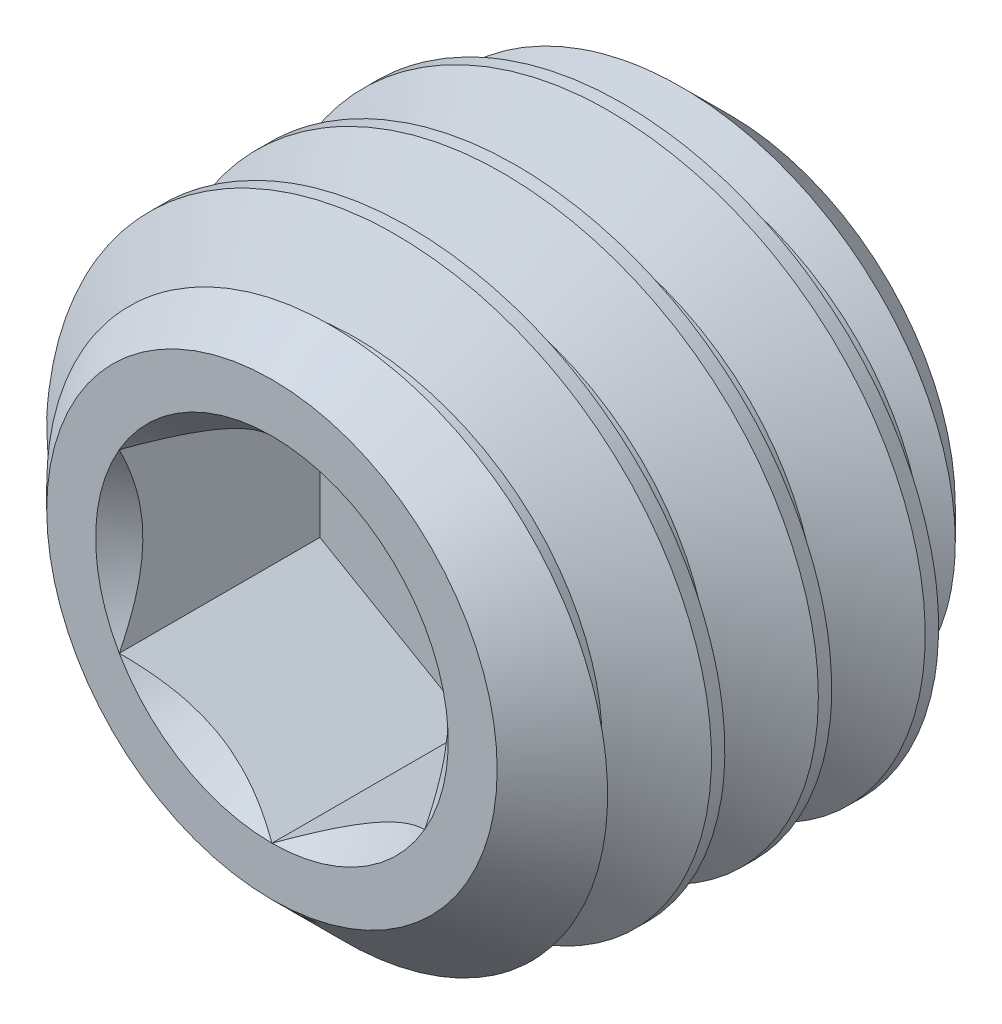
from build123d import *

# Parameters (mm, degrees)
SKETCH2_W          = 3
SKETCH2_H          = 2
CHAMFER1_SIZE      = 0.525
CUT_EXTRUDE1_DEPTH = 1.314
CUT_SWEEP1_PITCH   = 0.7


with BuildPart() as part:
    # Sketch2 → Revolve1 (revolve)
    with BuildSketch(Plane(origin=(0, 0, 0), x_dir=(0, 0, -1), z_dir=(1, 0, 0)), mode=Mode.PRIVATE) as revolve1_sk:
        with Locations((0, 1)):
            Rectangle(SKETCH2_W, SKETCH2_H)
    revolve(revolve1_sk.sketch.rotate(Axis((0, 0, 1.5), (0, 0, -1)), 90), axis=Axis((0, 0, 1.5), (0, 0, -1)))

    # Chamfer1
    chamfer1_edges = [part.edges().sort_by_distance(p)[0] for p in [
        (-2, 0, -1.5),
        (-2, 0, 1.5),
    ]]
    chamfer(chamfer1_edges, length=CHAMFER1_SIZE)

    # Sketch3 → Cut-Extrude1 (cut)
    with BuildSketch(Plane.XY.offset(1.5)):
        Polygon((0, 1.154700538), (-1, 0.577350269), (-1, -0.577350269), (0, -1.154700538), (1, -0.577350269), (1, 0.577350269), align=None)
    extrude(amount=-CUT_EXTRUDE1_DEPTH, mode=Mode.SUBTRACT)

    # Cut-Extrude2 cone 1 section (through the dimple's axis) → Cut-Extrude2 (revolve, cut)
    with BuildSketch(Plane(origin=(0, 0, 1.5), x_dir=(0, -1, 0), z_dir=(1, 0, 0))):
        Polygon((0, 0), (1.154700538, 0), (0, 1.154700538), align=None)
    revolve(axis=Axis((0, 0, 1.5), (0, 0, -1)), mode=Mode.SUBTRACT)

    # Cut-Sweep1: the profile of Sketch6 screwed along a right-hand helix of 5.285714 turns, 6 arcs to a turn; built about Z, then put on its axis
    cut_sweep1_z = Axis((0, 0, 0), (0, 0, 1))
    cut_sweep1_corners = [(2.037888611, 0, -0.634375), (2.037888611, 0, 0.021875), (1.545336663, 0, -0.2625), (1.545336663, 0, -0.35)]
    with BuildLine(mode=Mode.PRIVATE) as cut_sweep1_profile:
        Line(cut_sweep1_corners[0], cut_sweep1_corners[1])
        Line(cut_sweep1_corners[1], cut_sweep1_corners[2])
        Line(cut_sweep1_corners[2], cut_sweep1_corners[3])
        Line(cut_sweep1_corners[3], cut_sweep1_corners[0])
    cut_sweep1_cap = Face(cut_sweep1_profile.wire())
    cut_sweep1_turn_angles = [0, 30, 60, 90, 120, 150, 180, 210, 240, 270, 300, 330, 360]
    cut_sweep1_turn_weights = [1, 0.8660254037844387, 1, 0.8660254037844387, 1, 0.8660254037844387, 1, 0.8660254037844387, 1, 0.8660254037844387, 1, 0.8660254037844387, 1]
    cut_sweep1_turn_rails = [Edge.make_bspline([Vector(p[0], p[1], 0).rotate(cut_sweep1_z, cut_sweep1_turn_angles[k]) / cut_sweep1_turn_weights[k] + Vector(0, 0, p[2] + CUT_SWEEP1_PITCH * cut_sweep1_turn_angles[k] / 360) for k in range(13)], [0, 0, 0, 1, 1, 2, 2, 3, 3, 4, 4, 5, 5, 6, 6, 6], 2, cut_sweep1_turn_weights) for p in cut_sweep1_corners]
    cut_sweep1_turn_sides = [Face.make_surface_from_curves(cut_sweep1_turn_rails[p[0]], cut_sweep1_turn_rails[p[1]]) for p in [(0, 1), (1, 2), (2, 3), (3, 0)]]
    cut_sweep1_last_angles = [1800, 1830, 1860, 1881.428571429, 1902.857142857]
    cut_sweep1_last_weights = [1, 0.8660254037844387, 1, 0.930873748644186, 1]
    cut_sweep1_last_rails = [Edge.make_bspline([Vector(p[0], p[1], 0).rotate(cut_sweep1_z, cut_sweep1_last_angles[k]) / cut_sweep1_last_weights[k] + Vector(0, 0, p[2] + CUT_SWEEP1_PITCH * cut_sweep1_last_angles[k] / 360) for k in range(5)], [0, 0, 0, 1, 1, 2, 2, 2], 2, cut_sweep1_last_weights) for p in cut_sweep1_corners]
    cut_sweep1_last_sides = [Face.make_surface_from_curves(cut_sweep1_last_rails[p[0]], cut_sweep1_last_rails[p[1]]) for p in [(0, 1), (1, 2), (2, 3), (3, 0)]]
    cut_sweep1 = Plane(origin=(0, 0, 1.5), x_dir=(0, 1, 0), z_dir=(0, 0, -1)) * Solid(Shell([*[p.moved(Location((0, 0, CUT_SWEEP1_PITCH * i))) for i in range(5) for p in cut_sweep1_turn_sides], *cut_sweep1_last_sides, cut_sweep1_cap, cut_sweep1_cap.rotate(cut_sweep1_z, 1902.857142857).moved(Location((0, 0, CUT_SWEEP1_PITCH * 1902.857142857 / 360)))]))
    add(cut_sweep1, mode=Mode.SUBTRACT)


solid = part.part
